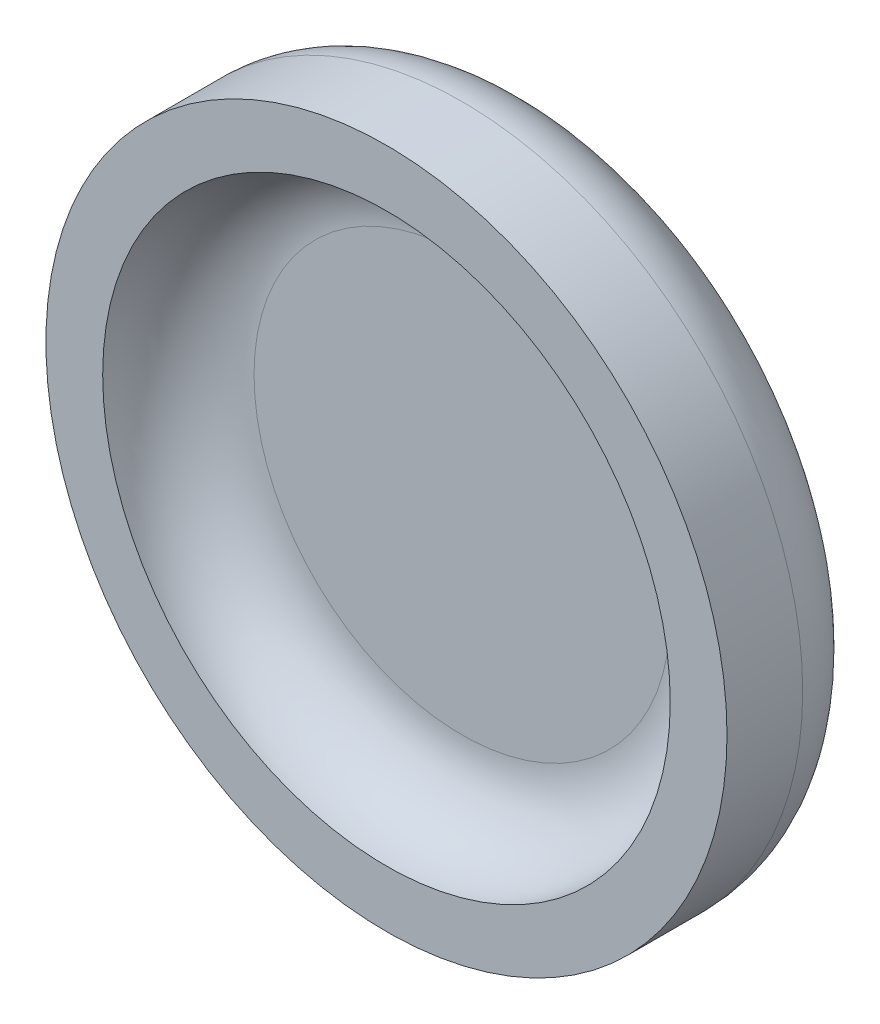
from build123d import *

# Parameters (mm, degrees)
SKETCH1_R           = 9
BOSS_EXTRUDE1_DEPTH = 4
SKETCH2_R           = 7.5
CUT_EXTRUDE1_DEPTH  = 2
FILLET1_R           = 2
FILLET2_R           = 2


with BuildPart() as part:
    # Sketch1 → Boss-Extrude1 (new body)
    with BuildSketch(Plane.XY):
        Circle(SKETCH1_R)
    extrude(amount=BOSS_EXTRUDE1_DEPTH)

    # Sketch2 → Cut-Extrude1 (cut)
    with BuildSketch(Plane.XY.offset(4)):
        Circle(SKETCH2_R)
    extrude(amount=-CUT_EXTRUDE1_DEPTH, mode=Mode.SUBTRACT)

    # Fillet1
    fillet1_edges = [part.edges().sort_by_distance(p)[0] for p in [
        (-9, 0, 0),
    ]]
    fillet(fillet1_edges, radius=FILLET1_R)

    # Fillet2
    fillet2_edges = [part.edges().sort_by_distance(p)[0] for p in [
        (-7.5, 0, 2),
    ]]
    fillet(fillet2_edges, radius=FILLET2_R - 0.0001)  # a hair under: the kernel refuses the full size


solid = part.part
